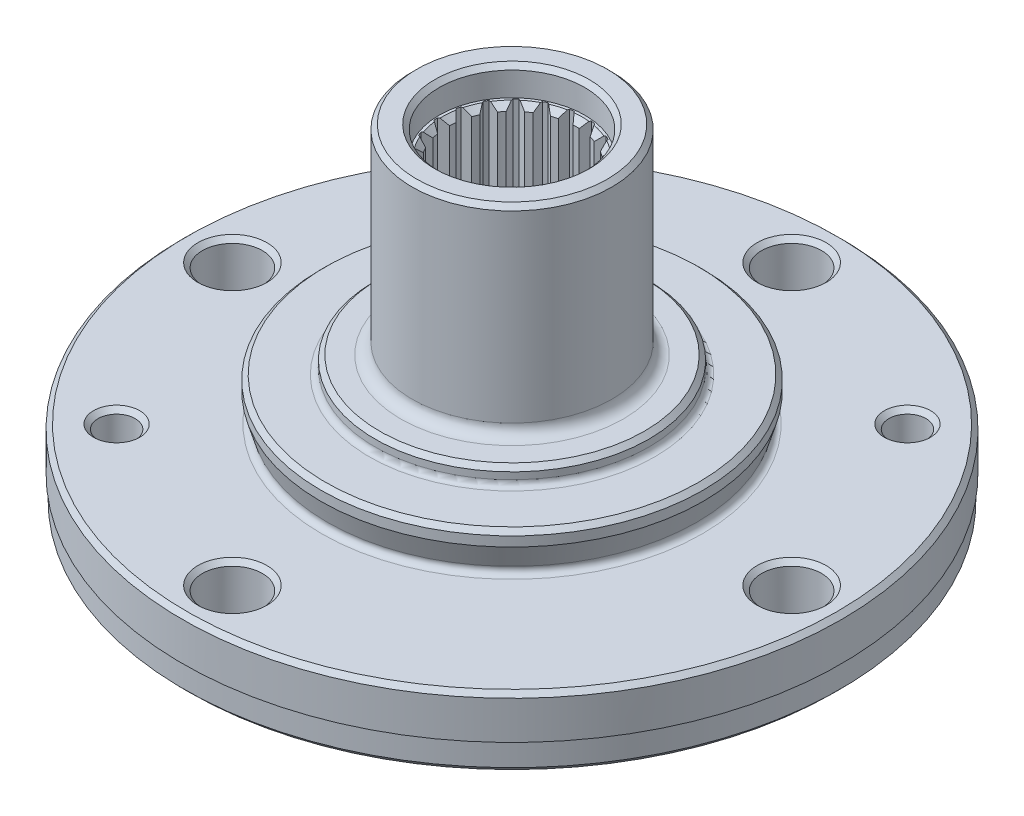
from build123d import *
from OCP.BRepFilletAPI import BRepFilletAPI_MakeChamfer

# Parameters (mm, degrees)
CHAMFER5_SIZE      = 1
CHAMFER4_SIZE      = 1
SKETCH2_R          = 5.25
SKETCH2_R_2        = 3.25
CUT_EXTRUDE1_DEPTH = 20
CHAMFER1_SIZE      = 0.8
CHAMFER2_SIZE      = 2
CHAMFER2_SIZE2     = 1.154700538
CHAMFER3_SIZE      = 1
CHAMFER3_SIZE2     = 1.08295891
CUT_EXTRUDE2_START = -54
CUT_EXTRUDE2_DEPTH = 54
FILLET1_R          = 1.5
CHAMFER6_SIZE      = 0.8
FILLET2_R          = 2
FILLET3_R          = 1
FILLET4_R          = 1
FILLET5_R          = 1


# Read off the part's stored shape, not the designer's step: Cut-Extrude2
with BuildPart() as part:
    # Sketch1 → Revolve1 (revolve)
    with BuildSketch(Plane.XY, mode=Mode.PRIVATE) as revolve1_sk:
        Polygon((24, -19.221576682), (25, -32.721576682), (29, -32.721576682), (29, -18.721576682), (29.5, -18.721576682), (29.5, -12.721576682), (57.5, -12.721576682), (57.5, -7.721576682), (57.75, -7.721576682), (57.75, -0.221576682), (32, -0.221576682), (33.5, 4.778423318), (33.5, 7.278423318), (24, 7.278423318), (24, 10.278423318), (17.5, 10.278423318), (17.5, 45.278423318), (12.75, 45.278423318), (12.75, 40.278423318), (11.25, 40.278423318), (11.25, -13.721576682), (23.25, -13.721576682), (23.25, -19.221576682), align=None)
    revolve(revolve1_sk.sketch.rotate(Axis((0, 70.730376941, 0), (0, -1, 0)), 180), axis=Axis((0, 70.730376941, 0), (0, -1, 0)))

    # Chamfer5
    chamfer5_edges = [part.edges().sort_by_distance(p)[0] for p in [
        (11.25, 40.278423318, 0),
    ]]
    chamfer(chamfer5_edges, length=CHAMFER5_SIZE)

    # Chamfer4
    chamfer4_edges = [part.edges().sort_by_distance(p)[0] for p in [
        (11.25, -13.721576682, 0),
    ]]
    chamfer(chamfer4_edges, length=CHAMFER4_SIZE)

    # Sketch2 → Cut-Extrude1 (cut)
    with BuildSketch(Plane.XZ.offset(12.721576682)):
        with Locations((-49, 0)):
            Circle(SKETCH2_R)
        with Locations((0, 49)):
            Circle(SKETCH2_R)
        with Locations((-34.648232278, 34.648232278)):
            Circle(SKETCH2_R_2)
        with Locations((49, 0)):
            Circle(SKETCH2_R)
        with Locations((0, -49)):
            Circle(SKETCH2_R)
        with Locations((34.648232278, -34.648232278)):
            Circle(SKETCH2_R_2)
    extrude(amount=-CUT_EXTRUDE1_DEPTH, mode=Mode.SUBTRACT)

    # Chamfer1
    chamfer1_edges = [part.edges().sort_by_distance(p)[0] for p in [
        (-54.25, -0.221576682, 0),
        (-54.25, -12.721576682, 0),
        (-37.898232278, -0.221576682, 34.648232278),
        (-37.898232278, -12.721576682, 34.648232278),
        (31.398232278, -0.221576682, -34.648232278),
        (31.398232278, -12.721576682, -34.648232278),
        (-5.25, -0.221576682, 49),
        (-5.25, -12.721576682, 49),
        (43.75, -0.221576682, 0),
        (43.75, -12.721576682, 0),
        (-5.25, -0.221576682, -49),
        (-5.25, -12.721576682, -49),
    ]]
    chamfer(chamfer1_edges, length=CHAMFER1_SIZE)

    # Chamfer2
    chamfer2_edges = [part.edges().sort_by_distance(p)[0] for p in [
        (29, -32.721576682, 0),
    ]]
    chamfer2_side = [part.faces().sort_by_distance(p)[0] for p in [
        (29, -25.721576682, 0),
    ]]
    chamfer(chamfer2_edges, length=CHAMFER2_SIZE, length2=CHAMFER2_SIZE2, reference=chamfer2_side[0])

    # Chamfer3: one chamfer whose edges measure the first distance from different faces: ONE call of the kernel's chamfer builder (chamfer() names one face for all edges)
    chamfer3_edges_1 = [part.edges().sort_by_distance(p)[0] for p in [
        (25, -32.721576682, 0),
    ]]
    chamfer3_side_1 = [part.faces().sort_by_distance(p)[0] for p in [
        (24.5, -25.971576682, 0),
    ]]
    chamfer3_edges_2 = [part.edges().sort_by_distance(p)[0] for p in [
        (57.5, -12.721576682, 0),
    ]]
    chamfer3 = BRepFilletAPI_MakeChamfer(part.part.solid().wrapped)
    for e in chamfer3_edges_1:
        chamfer3.Add(CHAMFER3_SIZE, CHAMFER3_SIZE2, e.wrapped, chamfer3_side_1[0].wrapped)  # the first distance lies on this face
    for e in chamfer3_edges_2:
        chamfer3.Add(CHAMFER3_SIZE, e.wrapped)
    add(Compound.cast(chamfer3.Shape()), mode=Mode.REPLACE)

    # Cut-Extrude2 outline → Cut-Extrude2 (cut)
    with BuildSketch(Plane.XZ.offset(13.721576682).offset(CUT_EXTRUDE2_START)):
        with BuildLine():
            Line((-2.21216743, 11.0303588), (-3.324441508, 12.049816958))
            ThreePointArc((-3.324441508, 12.049816958), (-3.684439681, 11.944660075), (-4.041121111, 11.828750578))
            Line((-4.041121111, 11.828750578), (-4.385843852, 10.359868421))
            ThreePointArc((-4.385843852, 10.359868421), (-3.315995711, 10.750194065), (-2.21216743, 11.0303588))
        make_face()
        with BuildLine():
            Line((-0.374999999, 12.494373737), (-1.137368292, 11.192358704))
            ThreePointArc((-1.137368292, 11.192358704), (1e-09, 11.25), (1.137368294, 11.192358704))
            Line((1.137368294, 11.192358704), (0.375, 12.494373736))
            ThreePointArc((0.375, 12.494373736), (1e-09, 12.500000003), (-0.374999999, 12.494373737))
        make_face()
        with BuildLine():
            ThreePointArc((-7.244617939, 8.606858365), (-6.337350653, 9.295186212), (-5.36514237, 9.888263111))
            Line((-5.36514237, 9.888263111), (-6.728491798, 10.534581064))
            ThreePointArc((-6.728491798, 10.534581064), (-7.041500727, 10.327984681), (-7.348170879, 10.11209102))
            Line((-7.348170879, 10.11209102), (-7.244617939, 8.606858365))
        make_face()
        with BuildLine():
            Line((3.324441508, 12.049816958), (2.212167432, 11.0303588))
            ThreePointArc((2.212167432, 11.0303588), (3.315995713, 10.750194065), (4.385843853, 10.359868421))
            Line((4.385843853, 10.359868421), (4.041121112, 11.828750577))
            ThreePointArc((4.041121112, 11.828750577), (3.684439681, 11.944660075), (3.324441508, 12.049816958))
        make_face()
        with BuildLine():
            ThreePointArc((-9.459675929, 6.089091173), (-8.795604177, 7.014260272), (-8.041400866, 7.86755185))
            Line((-8.041400866, 7.86755185), (-9.534686065, 8.083301411))
            ThreePointArc((-9.534686065, 8.083301411), (-9.772893533, 7.793622525), (-10.002303416, 7.4969278))
            Line((-10.002303416, 7.4969278), (-9.459675929, 6.089091173))
        make_face()
        with BuildLine():
            Line((6.728491799, 10.534581063), (5.365142372, 9.88826311))
            ThreePointArc((5.365142372, 9.88826311), (6.337350654, 9.29518621), (7.24461794, 8.606858364))
            Line((7.24461794, 8.606858364), (7.348170879, 10.11209102))
            ThreePointArc((7.348170879, 10.11209102), (7.041500728, 10.327984681), (6.728491799, 10.534581063))
        make_face()
        with BuildLine():
            ThreePointArc((-10.8342002, 3.030281508), (-10.472329672, 4.110086525), (-10.003145606, 5.147774081))
            Line((-10.003145606, 5.147774081), (-11.493681633, 4.913784956))
            ThreePointArc((-11.493681633, 4.913784956), (-11.63592186, 4.566762806), (-11.767687401, 4.215629645))
            Line((-11.767687401, 4.215629645), (-10.8342002, 3.030281508))
        make_face()
        with BuildLine():
            Line((9.534686066, 8.083301411), (8.041400867, 7.867551849))
            ThreePointArc((8.041400867, 7.867551849), (8.795604178, 7.01426027), (9.45967593, 6.089091172))
            Line((9.45967593, 6.089091172), (10.002303417, 7.496927799))
            ThreePointArc((10.002303417, 7.496927799), (9.772893533, 7.793622524), (9.534686066, 8.083301411))
        make_face()
        with BuildLine():
            ThreePointArc((-11.246058238, -0.297781966), (-11.218542718, 0.840713554), (-11.07606696, 1.970593995))
            Line((-11.07606696, 1.970593995), (-12.431413148, 1.307657143))
            ThreePointArc((-12.431413148, 1.307657143), (-12.465047467, 0.93412617), (-12.487460719, 0.559754295))
            Line((-12.487460719, 0.559754295), (-11.246058238, -0.297781966))
        make_face()
        with BuildLine():
            Line((11.493681633, 4.913784955), (10.003145606, 5.14777408))
            ThreePointArc((10.003145606, 5.14777408), (10.472329672, 4.110086524), (10.834200201, 3.030281507))
            Line((10.834200201, 3.030281507), (11.767687401, 4.215629644))
            ThreePointArc((11.767687401, 4.215629644), (11.635921861, 4.566762805), (11.493681633, 4.913784955))
        make_face()
        with BuildLine():
            ThreePointArc((-10.658654649, -3.599386207), (-10.967939012, -2.503360506), (-11.164831159, -1.381682016))
            Line((-11.164831159, -1.381682016), (-12.264559051, -2.414661746))
            ThreePointArc((-12.264559051, -2.414661746), (-12.186598905, -2.781511675), (-12.097668351, -3.145857679))
            Line((-12.097668351, -3.145857679), (-10.658654649, -3.599386207))
        make_face()
        with BuildLine():
            Line((12.431413148, 1.307657142), (11.076066961, 1.970593993))
            ThreePointArc((11.076066961, 1.970593993), (11.218542718, 0.840713552), (11.246058238, -0.297781968))
            Line((11.246058238, -0.297781968), (12.487460719, 0.559754295))
            ThreePointArc((12.487460719, 0.559754295), (12.465047467, 0.93412617), (12.431413148, 1.307657142))
        make_face()
        with BuildLine():
            ThreePointArc((-9.12418282, -6.581169187), (-9.742785793, -5.624999999), (-10.261551113, -4.611189516))
            Line((-10.261551113, -4.611189516), (-11.00794506, -5.922427342))
            ThreePointArc((-11.00794506, -5.922427342), (-10.82531755, -6.250000001), (-10.632945061, -6.571946394))
            Line((-10.632945061, -6.571946394), (-9.12418282, -6.581169187))
        make_face()
        with BuildLine():
            ThreePointArc((-6.778987306, -8.978186404), (-7.6519433, -8.246833558), (-8.446487219, -7.430972592))
            Line((-8.446487219, -7.430972592), (-8.773226843, -8.903959278))
            ThreePointArc((-8.773226843, -8.903959278), (-8.502159224, -9.1631484), (-8.22343794, -9.414088831))
            Line((-8.22343794, -9.414088831), (-6.778987306, -8.978186404))
        make_face()
        with BuildLine():
            Line((11.00794506, -5.922427342), (10.261551112, -4.611189518))
            ThreePointArc((10.261551112, -4.611189518), (9.742785792, -5.625000001), (9.124182819, -6.581169188))
            Line((9.124182819, -6.581169188), (10.63294506, -6.571946395))
            ThreePointArc((10.63294506, -6.571946395), (10.825317549, -6.250000002), (11.00794506, -5.922427342))
        make_face()
        with BuildLine():
            ThreePointArc((-3.831449022, -10.577452358), (-4.881192066, -10.135899763), (-5.880915868, -9.590481143))
            Line((-5.880915868, -9.590481143), (-5.75896892, -11.094335358))
            ThreePointArc((-5.75896892, -11.094335358), (-5.42354674, -11.262110851), (-5.08324227, -11.419748162))
            Line((-5.08324227, -11.419748162), (-3.831449022, -10.577452358))
        make_face()
        with BuildLine():
            Line((8.773226843, -8.903959279), (8.446487218, -7.430972593))
            ThreePointArc((8.446487218, -7.430972593), (7.6519433, -8.246833558), (6.778987305, -8.978186404))
            Line((6.778987305, -8.978186404), (8.223437939, -9.414088832))
            ThreePointArc((8.223437939, -9.414088832), (8.502159224, -9.1631484), (8.773226843, -8.903959279))
        make_face()
        with BuildLine():
            ThreePointArc((-0.543469677, -11.236865253), (-1.676725495, -11.124346795), (-2.792799335, -10.897833357))
            Line((-2.792799335, -10.897833357), (-2.233001336, -12.298931055))
            ThreePointArc((-2.233001336, -12.298931055), (-1.863028328, -12.36038533), (-1.491378217, -12.410712755))
            Line((-1.491378217, -12.410712755), (-0.543469677, -11.236865253))
        make_face()
        with BuildLine():
            Line((5.75896892, -11.094335359), (5.880915867, -9.590481144))
            ThreePointArc((5.880915867, -9.590481144), (4.881192064, -10.135899764), (3.83144902, -10.577452359))
            Line((3.83144902, -10.577452359), (5.083242269, -11.419748163))
            ThreePointArc((5.083242269, -11.419748163), (5.42354674, -11.262110851), (5.75896892, -11.094335359))
        make_face()
        with BuildLine():
            ThreePointArc((2.792799333, -10.897833357), (1.676725494, -11.124346795), (0.543469676, -11.236865253))
            Line((0.543469676, -11.236865253), (1.491378216, -12.410712755))
            ThreePointArc((1.491378216, -12.410712755), (1.863028327, -12.360385331), (2.233001335, -12.298931055))
            Line((2.233001335, -12.298931055), (2.792799333, -10.897833357))
        make_face()
        with BuildLine():
            Line((11.815157683, -3.234895503), (12.097668351, -3.14585768))
            ThreePointArc((12.097668351, -3.14585768), (12.186598905, -2.781511675), (12.264559051, -2.414661747))
            Line((12.264559051, -2.414661747), (12.048657798, -2.211864656))
            ThreePointArc((12.048657798, -2.211864656), (11.942866924, -2.725881442), (11.815157683, -3.234895503))
        make_face()
    extrude(amount=CUT_EXTRUDE2_DEPTH, mode=Mode.SUBTRACT)

    # Fillet1
    fillet1_edges = [part.edges().sort_by_distance(p)[0] for p in [
        (29.5, -12.721576682, 0),
    ]]
    fillet(fillet1_edges, radius=FILLET1_R)

    # Chamfer6
    chamfer6_edges = [part.edges().sort_by_distance(p)[0] for p in [
        (12.75, 45.278423318, 0),
        (17.5, 45.278423318, 0),
        (24, 10.278423318, 0),
        (33.5, 7.278423318, 0),
        (57.75, -0.221576682, 0),
    ]]
    chamfer(chamfer6_edges, length=CHAMFER6_SIZE)

    # Fillet2
    fillet2_edges = [part.edges().sort_by_distance(p)[0] for p in [
        (17.5, 10.278423318, 0),
    ]]
    fillet(fillet2_edges, radius=FILLET2_R)

    # Fillet3
    fillet3_edges = [part.edges().sort_by_distance(p)[0] for p in [
        (32, -0.221576682, 0),
    ]]
    fillet(fillet3_edges, radius=FILLET3_R)

    # Fillet4
    fillet4_edges = [part.edges().sort_by_distance(p)[0] for p in [
        (24, 7.278423318, 0),
    ]]
    fillet(fillet4_edges, radius=FILLET4_R)

    # Fillet5
    fillet5_edges = [part.edges().sort_by_distance(p)[0] for p in [
        (23.25, -13.721576682, 0),
    ]]
    fillet(fillet5_edges, radius=FILLET5_R)


solid = part.part
